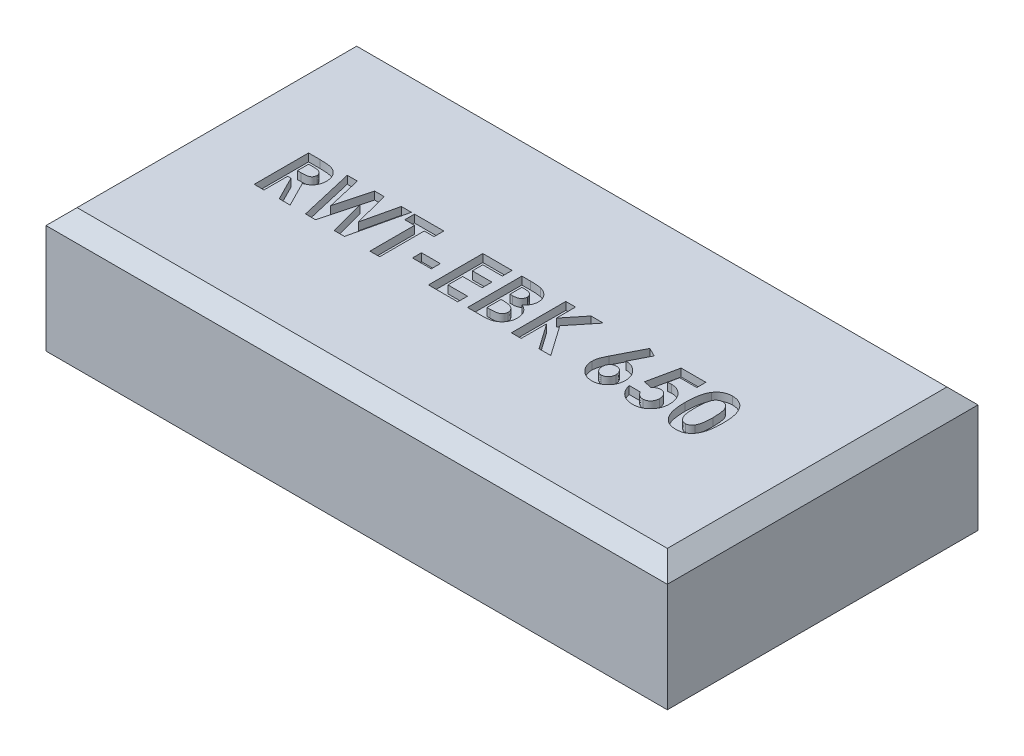
from build123d import *

# Parameters (mm, degrees)
SKETCH1_W           = 40
SKETCH1_H           = 20
BOSS_EXTRUDE1_DEPTH = 8
CHAMFER1_SIZE       = 1
SKETCH4_W           = 1.211538461
SKETCH4_H           = 0.583333333
CUT_EXTRUDE3_DEPTH  = 0.5


with BuildPart() as part:
    # Sketch1 → Boss-Extrude1 (new body)
    with BuildSketch(Plane(origin=(0, 0, 0), x_dir=(1, 0, 0), z_dir=(0, 1, 0))):
        with Locations((0, 2.318501171)):
            Rectangle(SKETCH1_W, SKETCH1_H)
    extrude(amount=BOSS_EXTRUDE1_DEPTH)

    # Chamfer1
    chamfer1_edges = [part.edges().sort_by_distance(p)[0] for p in [
        (0, 8, 7.681498829),
        (-20, 8, -2.318501171),
        (0, 8, -12.318501171),
        (20, 8, -2.318501171),
    ]]
    chamfer(chamfer1_edges, length=CHAMFER1_SIZE)

    # Sketch4 → Cut-Extrude3 (cut)
    # profile 1 of 10: a face of its own
    with BuildSketch(Plane(origin=(0, 8, 0), x_dir=(1, 0, 0), z_dir=(0, 1, 0))):
        with BuildLine():
            Line((-14.596153846, 3.818501171), (-13.864182692, 3.818501171))
            add(Edge.make_bspline(
                [(-13.864182692, 3.818501171), (-13.815799622, 3.818329439), (-13.722745349, 3.81799915), (-13.588566169, 3.81278806), (-13.46530414, 3.805536401), (-13.352776761, 3.794470177), (-13.251032173, 3.779797701), (-13.159968404, 3.76250128), (-13.079588115, 3.742788301), (-13.009213411, 3.718224373), (-12.945703721, 3.690516634), (-12.886503859, 3.658679935), (-12.830307791, 3.623068786), (-12.777491125, 3.582746162), (-12.727594872, 3.538437457), (-12.6805249, 3.49009807), (-12.636946351, 3.437318103), (-12.597129066, 3.380431058), (-12.560838815, 3.320587191), (-12.528765845, 3.257704336), (-12.502684052, 3.191738763), (-12.479637993, 3.123643816), (-12.463038663, 3.052446065), (-12.451494071, 2.978838632), (-12.443041573, 2.902562411), (-12.442555595, 2.850743733), (-12.442307692, 2.824310466)],
                knots=[0, 0, 0, 0, 1.749336639, 3.364467119, 4.854658419, 6.213483162, 7.451590619, 8.570285859, 9.5643256, 10.440900261, 11.26203566, 12.067320669, 12.869050712, 13.665104639, 14.467235401, 15.27997916, 16.102287765, 16.939272006, 17.78853747, 18.631303466, 19.488103222, 20.351255419, 21.228522269, 22.127379805, 23.044756219, 24, 24, 24, 24], degree=3))
            add(Edge.make_bspline(
                [(-12.442307692, 2.824310466), (-12.442951654, 2.796720207), (-12.444214347, 2.742620739), (-12.451015895, 2.663153032), (-12.46344699, 2.587123888), (-12.48227569, 2.514755912), (-12.503916836, 2.4451484), (-12.532694008, 2.379585653), (-12.565171892, 2.317114157), (-12.603744925, 2.258617595), (-12.646076944, 2.20279664), (-12.695308193, 2.151790002), (-12.748249241, 2.102856265), (-12.807876098, 2.059060474), (-12.871560358, 2.017441316), (-12.940567358, 1.979723274), (-13.014446736, 1.944958206), (-13.066387598, 1.925570802), (-13.092948718, 1.91565662)],
                knots=[0, 0, 0, 0, 1.099860209, 2.156625411, 3.176576793, 4.16617041, 5.135385252, 6.078461593, 7.016046972, 7.938469504, 8.868247731, 9.803980173, 10.76021508, 11.73834243, 12.748633912, 13.790971185, 14.870363756, 16, 16, 16, 16], degree=3))
            Line((-13.092948718, 1.91565662), (-12.28525641, 0.318501171))
            Line((-12.28525641, 0.318501171), (-12.983573718, 0.318501171))
            Line((-12.983573718, 0.318501171), (-13.754807692, 1.844142197))
            Line((-13.754807692, 1.844142197), (-13.967948718, 1.844142197))
            Line((-13.967948718, 1.844142197), (-13.967948718, 0.318501171))
            Line((-13.967948718, 0.318501171), (-14.596153846, 0.318501171))
            Line((-14.596153846, 0.318501171), (-14.596153846, 3.818501171))
        make_face()
        with BuildLine():
            Line((-13.967948718, 2.472347325), (-13.723257212, 2.472347325))
            add(Edge.make_bspline(
                [(-13.723257212, 2.472347325), (-13.693341641, 2.472684254), (-13.636059751, 2.473329401), (-13.55368087, 2.476321861), (-13.4788612, 2.483532211), (-13.41127944, 2.492642218), (-13.350595524, 2.503161037), (-13.297350732, 2.518235143), (-13.250724642, 2.534387429), (-13.211269776, 2.554460531), (-13.177560445, 2.577288002), (-13.148454596, 2.603220576), (-13.124379885, 2.633234229), (-13.104565169, 2.666513318), (-13.089151475, 2.70335219), (-13.07790066, 2.743346436), (-13.071613117, 2.786951643), (-13.070889714, 2.817045173), (-13.070512821, 2.832723927)],
                knots=[0, 0, 0, 0, 1.688639943, 3.233382647, 4.650958383, 5.928841754, 7.082724185, 8.122798841, 9.049171256, 9.863274652, 10.613301712, 11.341792392, 12.054588806, 12.776240173, 13.521029143, 14.301969904, 15.115324896, 16, 16, 16, 16], degree=3))
            add(Edge.make_bspline(
                [(-13.070512821, 2.832723927), (-13.071225372, 2.851273039), (-13.072625049, 2.88770933), (-13.086514186, 2.940164814), (-13.108622693, 2.988715953), (-13.1389274, 3.033143381), (-13.177092239, 3.072091531), (-13.220889403, 3.106424636), (-13.27126414, 3.133572687), (-13.317907356, 3.151479252), (-13.36034178, 3.162192934), (-13.398637509, 3.170176676), (-13.442984193, 3.175834983), (-13.493415313, 3.181836624), (-13.549802317, 3.185728385), (-13.612452548, 3.188568594), (-13.681186076, 3.189730664), (-13.729099873, 3.190102157), (-13.754106571, 3.190296043)],
                knots=[0, 0, 0, 0, 1.020303359, 2.004196876, 2.966617323, 3.9489082, 4.950758222, 5.960522915, 7.003732012, 8.091992268, 8.70421221, 9.413913587, 10.24622431, 11.166358409, 12.212345909, 13.359657661, 14.621978493, 16, 16, 16, 16], degree=3))
            Line((-13.754106571, 3.190296043), (-13.967948718, 3.190296043))
            Line((-13.967948718, 3.190296043), (-13.967948718, 2.472347325))
        make_face(mode=Mode.SUBTRACT)
    # profile 2 of 10: a face of its own
    with BuildSketch(Plane(origin=(0, 8, 0), x_dir=(1, 0, 0), z_dir=(0, 1, 0))):
        Polygon((-12.105769231, 3.818501171), (-11.457231571, 3.818501171), (-10.939102564, 1.584026011), (-10.345252404, 3.818501171), (-9.734575321, 3.818501171), (-9.144230769, 1.584026011), (-8.627504006, 3.818501171), (-7.977564103, 3.818501171), (-8.787359776, 0.318501171), (-9.443609776, 0.318501171), (-10.041666667, 2.581021203), (-10.643229167, 0.318501171), (-11.294571314, 0.318501171), align=None)
    # profile 3 of 10: a face of its own
    with BuildSketch(Plane(origin=(0, 8, 0), x_dir=(1, 0, 0), z_dir=(0, 1, 0))):
        Polygon((-7.775641026, 3.818501171), (-5.891025641, 3.818501171), (-5.891025641, 3.190296043), (-6.519230769, 3.190296043), (-6.519230769, 0.318501171), (-7.147435897, 0.318501171), (-7.147435897, 3.190296043), (-7.775641026, 3.190296043), align=None)
    # profile 4 of 10: a face of its own
    with BuildSketch(Plane(origin=(0, 8, 0), x_dir=(1, 0, 0), z_dir=(0, 1, 0))):
        with Locations((-4.791666667, 1.597347325)):
            Rectangle(SKETCH4_W, SKETCH4_H)
    # profile 5 of 10: a face of its own
    with BuildSketch(Plane(origin=(0, 8, 0), x_dir=(1, 0, 0), z_dir=(0, 1, 0))):
        Polygon((-3.378205128, 3.818501171), (-1.493589744, 3.818501171), (-1.493589744, 3.190296043), (-2.75, 3.190296043), (-2.75, 2.51721912), (-1.493589744, 2.51721912), (-1.493589744, 1.889013991), (-2.75, 1.889013991), (-2.75, 0.946706299), (-1.493589744, 0.946706299), (-1.493589744, 0.318501171), (-3.378205128, 0.318501171), align=None)
    # profile 6 of 10: a face of its own
    with BuildSketch(Plane(origin=(0, 8, 0), x_dir=(1, 0, 0), z_dir=(0, 1, 0))):
        with BuildLine():
            Line((-0.865384615, 0.318501171), (-0.865384615, 3.818501171))
            Line((-0.865384615, 3.818501171), (-0.304487179, 3.818501171))
            add(Edge.make_bspline(
                [(-0.304487179, 3.818501171), (-0.265220852, 3.818505652), (-0.189241252, 3.818514323), (-0.079622519, 3.814664873), (0.022039599, 3.809685178), (0.115421572, 3.804114058), (0.200682344, 3.794513904), (0.277692262, 3.784396391), (0.346605192, 3.772195293), (0.389210312, 3.76125053), (0.409254808, 3.756101331)],
                knots=[0, 0, 0, 0, 1.311965854, 2.538629056, 3.664479157, 4.713267157, 5.663616078, 6.530575999, 7.308677837, 8, 8, 8, 8], degree=3))
            add(Edge.make_bspline(
                [(0.409254808, 3.756101331), (0.435575266, 3.748838294), (0.487224455, 3.734585883), (0.561202576, 3.705802524), (0.631381143, 3.673807779), (0.697674471, 3.637307759), (0.759675491, 3.595861807), (0.817148578, 3.549140995), (0.871333285, 3.499020694), (0.920305637, 3.444104065), (0.964568575, 3.386074475), (1.003025131, 3.324947127), (1.03643895, 3.2616567), (1.063178757, 3.195406725), (1.083326699, 3.126502301), (1.09806282, 3.055237661), (1.107613822, 2.981387306), (1.108516267, 2.931144495), (1.108974359, 2.905640594)],
                knots=[0, 0, 0, 0, 1.099996261, 2.158545794, 3.195537121, 4.207578794, 5.205712374, 6.197378256, 7.190519799, 8.17788031, 9.159561366, 10.129234751, 11.085776129, 12.040971148, 13.00380137, 13.975669004, 14.972423361, 16, 16, 16, 16], degree=3))
            add(Edge.make_bspline(
                [(1.108974359, 2.905640594), (1.107776583, 2.872874775), (1.105418909, 2.808379286), (1.090357925, 2.713647082), (1.062116233, 2.624111532), (1.025162666, 2.538122532), (0.974917368, 2.456000819), (0.911115557, 2.377785442), (0.834790614, 2.30106803), (0.776245169, 2.255081117), (0.745793269, 2.231161427)],
                knots=[0, 0, 0, 0, 0.986156485, 1.941127874, 2.875419072, 3.804401753, 4.751181392, 5.761612777, 6.835722519, 8, 8, 8, 8], degree=3))
            add(Edge.make_bspline(
                [(0.745793269, 2.231161427), (0.770470028, 2.218564156), (0.818854324, 2.193864392), (0.887545811, 2.153265354), (0.951146629, 2.110083128), (1.009941945, 2.065186558), (1.062698461, 2.016672412), (1.111594582, 1.967336144), (1.154218027, 1.914350989), (1.192333195, 1.85960544), (1.225462281, 1.802306775), (1.254314061, 1.742551757), (1.278684124, 1.680136252), (1.299321324, 1.615377904), (1.314712554, 1.548053973), (1.324747963, 1.478140383), (1.332431699, 1.405875574), (1.333029422, 1.35665059), (1.333333333, 1.331622165)],
                knots=[0, 0, 0, 0, 1.164658916, 2.283573913, 3.35186032, 4.395461096, 5.390182219, 6.362969632, 7.312859996, 8.245001507, 9.165155236, 10.092416118, 11.032087915, 11.979892451, 12.947605196, 13.931445124, 14.948243989, 16, 16, 16, 16], degree=3))
            add(Edge.make_bspline(
                [(1.333333333, 1.331622165), (1.331361149, 1.283819302), (1.327469051, 1.189480545), (1.29901193, 1.050969584), (1.249676325, 0.91964863), (1.18342878, 0.796039608), (1.101799059, 0.683720797), (1.007948289, 0.585330494), (0.902821331, 0.502045287), (0.805829006, 0.445834233), (0.721938284, 0.40811136), (0.652453165, 0.384788701), (0.577827621, 0.363182624), (0.49669469, 0.348010391), (0.410525202, 0.334123096), (0.318478999, 0.325548791), (0.220728113, 0.319738197), (0.153588579, 0.318921849), (0.118990385, 0.318501171)],
                knots=[0, 0, 0, 0, 1.284142165, 2.534249414, 3.780121997, 5.041676246, 6.291546858, 7.49970053, 8.684500223, 9.883330709, 10.50184324, 11.153274765, 11.851151195, 12.587658647, 13.369265475, 14.195992086, 15.070362669, 16, 16, 16, 16], degree=3))
            Line((0.118990385, 0.318501171), (-0.865384615, 0.318501171))
        make_face()
        with BuildLine():
            Line((-0.237179487, 3.190296043), (-0.237179487, 2.42747553))
            Line((-0.237179487, 2.42747553), (-0.0703125, 2.42747553))
            add(Edge.make_bspline(
                [(-0.0703125, 2.42747553), (-0.047633777, 2.427673297), (-0.003853875, 2.428055074), (0.059381549, 2.432972233), (0.118180282, 2.441361212), (0.172319311, 2.453065948), (0.222302963, 2.467929257), (0.267811927, 2.485813017), (0.308646108, 2.507633149), (0.356085982, 2.540135198), (0.406233349, 2.587963419), (0.450377513, 2.657061193), (0.476378131, 2.736523371), (0.479273899, 2.792566252), (0.480769231, 2.821505979)],
                knots=[0, 0, 0, 0, 1.065314748, 2.056525647, 2.977365736, 3.853934255, 4.656397591, 5.425096493, 6.14721249, 6.826394842, 8.123232004, 9.372140726, 10.643011755, 12, 12, 12, 12], degree=3))
            add(Edge.make_bspline(
                [(0.480769231, 2.821505979), (0.479572691, 2.848612841), (0.47725923, 2.901022871), (0.451079951, 2.97461122), (0.410418355, 3.039825558), (0.362411626, 3.084459439), (0.317203962, 3.114943064), (0.278494386, 3.135015233), (0.236007719, 3.152983634), (0.188921466, 3.166722711), (0.137504514, 3.17703203), (0.082006625, 3.184602991), (0.022332045, 3.189756109), (-0.018885315, 3.190112204), (-0.040164263, 3.190296043)],
                knots=[0, 0, 0, 0, 1.347982417, 2.606269829, 3.849316587, 5.153353503, 5.842674298, 6.568177932, 7.326619318, 8.142485038, 9.012069166, 9.942760135, 10.937925643, 12, 12, 12, 12], degree=3))
            Line((-0.040164263, 3.190296043), (-0.237179487, 3.190296043))
        make_face(mode=Mode.SUBTRACT)
        with BuildLine():
            Line((-0.237179487, 1.844142197), (-0.237179487, 0.946706299))
            Line((-0.237179487, 0.946706299), (-0.056290064, 0.946706299))
            add(Edge.make_bspline(
                [(-0.056290064, 0.946706299), (-0.020527995, 0.946910607), (0.048229046, 0.947303413), (0.146723385, 0.952049449), (0.236279363, 0.960603342), (0.316659689, 0.971282188), (0.387987483, 0.985750355), (0.450021639, 1.004144774), (0.503612874, 1.02438184), (0.548439854, 1.049377018), (0.585060929, 1.078465208), (0.618107609, 1.108194036), (0.645051813, 1.142489048), (0.666370569, 1.179878054), (0.684821916, 1.219432285), (0.695950465, 1.262696318), (0.704423352, 1.308387911), (0.704889637, 1.339991798), (0.705128205, 1.356161427)],
                knots=[0, 0, 0, 0, 1.753078804, 3.370512758, 4.83203934, 6.162291463, 7.344201807, 8.395507345, 9.331626367, 10.147333109, 10.898971645, 11.62040215, 12.321813352, 13.025280112, 13.727906689, 14.453419512, 15.208716525, 16, 16, 16, 16], degree=3))
            add(Edge.make_bspline(
                [(0.705128205, 1.356161427), (0.704602095, 1.374651653), (0.703577374, 1.410665639), (0.695208464, 1.463303922), (0.67999942, 1.512445252), (0.660842888, 1.559346239), (0.634185556, 1.602327663), (0.602504228, 1.642876951), (0.564225095, 1.679620976), (0.521177978, 1.714782156), (0.470967777, 1.745567673), (0.413570936, 1.772279563), (0.348675643, 1.79458835), (0.27608088, 1.81235062), (0.196104895, 1.827425213), (0.108163951, 1.83642641), (0.012990452, 1.843120995), (-0.053004401, 1.843794061), (-0.087139423, 1.844142197)],
                knots=[0, 0, 0, 0, 0.845221588, 1.646264278, 2.427170338, 3.19324141, 3.95557735, 4.731569926, 5.540061037, 6.376114724, 7.268642756, 8.224665384, 9.265483498, 10.400594375, 11.639216012, 12.983232105, 14.439614077, 16, 16, 16, 16], degree=3))
            Line((-0.087139423, 1.844142197), (-0.237179487, 1.844142197))
        make_face(mode=Mode.SUBTRACT)
    # profile 7 of 10: a face of its own
    with BuildSketch(Plane(origin=(0, 8, 0), x_dir=(1, 0, 0), z_dir=(0, 1, 0))):
        Polygon((1.961538462, 3.818501171), (2.58974359, 3.818501171), (2.58974359, 2.586630177), (3.582532051, 3.818501171), (4.375500801, 3.818501171), (3.128205128, 2.270424248), (4.496794872, 0.318501171), (3.740284455, 0.318501171), (2.58974359, 1.959827293), (2.58974359, 0.318501171), (1.961538462, 0.318501171), align=None)
    # profile 8 of 10: a face of its own
    with BuildSketch(Plane(origin=(0, 8, 0), x_dir=(1, 0, 0), z_dir=(0, 1, 0))):
        with BuildLine():
            Line((7.287259615, 3.908244761), (7.843249199, 3.626393799))
            Line((7.843249199, 3.626393799), (7.233273237, 2.42747553))
            add(Edge.make_bspline(
                [(7.233273237, 2.42747553), (7.269310045, 2.426542519), (7.340290447, 2.4247048), (7.444723706, 2.409852053), (7.544563845, 2.384175214), (7.640817549, 2.350140634), (7.732308207, 2.304431854), (7.820509327, 2.250058876), (7.903139102, 2.183745181), (7.982092161, 2.110273125), (8.053883772, 2.028876646), (8.116247478, 1.941413544), (8.170596347, 1.850011807), (8.21284497, 1.752626555), (8.246924117, 1.650872061), (8.271513721, 1.544341567), (8.285542778, 1.432726586), (8.287476918, 1.356901473), (8.288461538, 1.31830085)],
                knots=[0, 0, 0, 0, 1.013260694, 1.995783107, 2.958651975, 3.908806537, 4.861209129, 5.829647963, 6.817170299, 7.835534541, 8.860094905, 9.863329007, 10.853101798, 11.844815043, 12.84250023, 13.867713965, 14.914507806, 16, 16, 16, 16], degree=3))
            add(Edge.make_bspline(
                [(8.288461538, 1.31830085), (8.287538867, 1.281092192), (8.285715142, 1.20754663), (8.270639637, 1.099526903), (8.246276829, 0.995888293), (8.211457485, 0.896837778), (8.167199282, 0.801891196), (8.113074498, 0.711104263), (8.048634272, 0.6251554), (7.975543562, 0.544501298), (7.895642808, 0.470984488), (7.81142306, 0.405638468), (7.722170652, 0.351660177), (7.629572559, 0.306074244), (7.531923994, 0.272057263), (7.430686271, 0.246380336), (7.325091675, 0.231563634), (7.253416769, 0.229700417), (7.217147436, 0.228757581)],
                knots=[0, 0, 0, 0, 1.049934834, 2.075270938, 3.072134561, 4.05064612, 5.033440221, 6.024524368, 7.028587226, 8.060776465, 9.092543989, 10.090062252, 11.064205434, 12.031961459, 12.998029633, 13.977230324, 14.976426867, 16, 16, 16, 16], degree=3))
            add(Edge.make_bspline(
                [(7.217147436, 0.228757581), (7.179220735, 0.229531316), (7.104643009, 0.231052761), (6.995517131, 0.248088938), (6.890856023, 0.273734527), (6.791247896, 0.31035207), (6.696073317, 0.356977567), (6.606452795, 0.414671928), (6.521631401, 0.482798942), (6.442513456, 0.559825856), (6.371234084, 0.644198302), (6.307658842, 0.731798868), (6.253874104, 0.822765019), (6.210336613, 0.916999493), (6.176367653, 1.01420201), (6.152732185, 1.114557051), (6.137331496, 1.217798425), (6.135526117, 1.287863863), (6.134615385, 1.323208703)],
                knots=[0, 0, 0, 0, 1.063775006, 2.091769615, 3.092589432, 4.084662827, 5.064601646, 6.061867366, 7.070035304, 8.113879863, 9.156342271, 10.166834137, 11.149076039, 12.117706134, 13.076241869, 14.034148791, 15.008317125, 16, 16, 16, 16], degree=3))
            add(Edge.make_bspline(
                [(6.134615385, 1.323208703), (6.135096598, 1.350579146), (6.136061702, 1.405472389), (6.145760426, 1.487672036), (6.160505893, 1.570087449), (6.17759782, 1.639632185), (6.19519736, 1.698439537), (6.212911432, 1.748206609), (6.234864121, 1.803437178), (6.259959296, 1.86427228), (6.28898611, 1.930638729), (6.321792931, 2.002355629), (6.358461434, 2.079966073), (6.384611127, 2.133272431), (6.398237179, 2.161049248)],
                knots=[0, 0, 0, 0, 1.110454016, 2.227089276, 3.35462975, 4.507227546, 5.131400587, 5.845402449, 6.650387134, 7.543487832, 8.516250726, 9.590168902, 10.744287919, 12, 12, 12, 12], degree=3))
            Line((6.398237179, 2.161049248), (7.287259615, 3.908244761))
        make_face()
        with BuildLine():
            add(Edge.make_bspline(
                [(7.203125, 1.844142197), (7.172981806, 1.842759592), (7.113995532, 1.840054016), (7.030125872, 1.81171991), (6.953655771, 1.767270749), (6.887370541, 1.705366696), (6.831929046, 1.631388922), (6.79118869, 1.547007389), (6.766681101, 1.453348146), (6.76413492, 1.387863165), (6.762820513, 1.354058062)],
                knots=[0, 0, 0, 0, 0.981744412, 1.921144944, 2.858899012, 3.85339082, 4.86292663, 5.863643845, 6.897155691, 8, 8, 8, 8], degree=3))
            add(Edge.make_bspline(
                [(6.762820513, 1.354058062), (6.764376812, 1.320241702), (6.767403918, 1.254466622), (6.792833024, 1.159915576), (6.83446836, 1.073617836), (6.892859264, 0.998659696), (6.961409347, 0.936438636), (7.037423258, 0.890423187), (7.119633057, 0.862154387), (7.176499583, 0.858705218), (7.205228365, 0.856962709)],
                knots=[0, 0, 0, 0, 1.098279937, 2.136227893, 3.159405121, 4.194678092, 5.206500211, 6.154139736, 7.067477469, 8, 8, 8, 8], degree=3))
            add(Edge.make_bspline(
                [(7.205228365, 0.856962709), (7.235569206, 0.858736253), (7.295072865, 0.862214481), (7.380910794, 0.889293782), (7.459324258, 0.934538321), (7.528656928, 0.996560175), (7.588212374, 1.070662942), (7.629418727, 1.157467583), (7.656023432, 1.252701065), (7.658813782, 1.319514894), (7.66025641, 1.354058062)],
                knots=[0, 0, 0, 0, 0.96921794, 1.900804717, 2.848419905, 3.844199796, 4.861108892, 5.867439427, 6.897452859, 8, 8, 8, 8], degree=3))
            add(Edge.make_bspline(
                [(7.66025641, 1.354058062), (7.658612993, 1.387843426), (7.655430323, 1.453272729), (7.631524703, 1.547370744), (7.588842831, 1.631427039), (7.532146927, 1.705672064), (7.463580512, 1.767548514), (7.384049921, 1.81207045), (7.296348955, 1.840003817), (7.234652722, 1.842742624), (7.203125, 1.844142197)],
                knots=[0, 0, 0, 0, 1.083229974, 2.097801324, 3.086792542, 4.086858909, 5.079819718, 6.026392613, 6.991456328, 8, 8, 8, 8], degree=3))
        make_face(mode=Mode.SUBTRACT)
    # profile 9 of 10: a face of its own
    with BuildSketch(Plane(origin=(0, 8, 0), x_dir=(1, 0, 0), z_dir=(0, 1, 0))):
        with BuildLine():
            Line((9.387119391, 3.818501171), (10.980769231, 3.818501171))
            Line((10.980769231, 3.818501171), (10.980769231, 3.235167838))
            Line((10.980769231, 3.235167838), (9.884915865, 3.235167838))
            Line((9.884915865, 3.235167838), (9.748197115, 2.573308863))
            add(Edge.make_bspline(
                [(9.748197115, 2.573308863), (9.766827002, 2.578497522), (9.803568967, 2.588730623), (9.858920782, 2.598993128), (9.912564404, 2.605644958), (9.947765022, 2.606532224), (9.96484375, 2.606962709)],
                knots=[0, 0, 0, 0, 1.05461699, 2.079921384, 3.068411212, 4, 4, 4, 4], degree=3))
            add(Edge.make_bspline(
                [(9.96484375, 2.606962709), (10.002060088, 2.606109919), (10.075421688, 2.60442888), (10.1827404, 2.588470341), (10.285504407, 2.563336125), (10.383399238, 2.527489548), (10.476329265, 2.480834303), (10.564407137, 2.424394534), (10.647740954, 2.358071113), (10.724850358, 2.281822516), (10.795701698, 2.19809983), (10.857302898, 2.107544887), (10.909914167, 2.011448911), (10.951759351, 1.909214572), (10.984787138, 1.801483971), (11.008653754, 1.688188071), (11.022767277, 1.569192598), (11.024670399, 1.488010495), (11.025641026, 1.446606139)],
                knots=[0, 0, 0, 0, 1.01440847, 1.999622559, 2.951875003, 3.895578053, 4.836219714, 5.782137149, 6.743708247, 7.735272588, 8.734977101, 9.730283169, 10.717124674, 11.717316708, 12.737475749, 13.78628267, 14.87096371, 16, 16, 16, 16], degree=3))
            add(Edge.make_bspline(
                [(11.025641026, 1.446606139), (11.024454904, 1.404731748), (11.022114339, 1.322101333), (11.006844297, 1.200605395), (10.979892399, 1.084239715), (10.94287127, 0.972692784), (10.894098303, 0.866784445), (10.835442135, 0.765417568), (10.765911048, 0.669344566), (10.68618738, 0.579550304), (10.599517296, 0.497476624), (10.507234115, 0.425276252), (10.409986156, 0.364520223), (10.30777107, 0.31541908), (10.2011753, 0.276571129), (10.090166491, 0.248291676), (9.974205155, 0.232074981), (9.895482475, 0.229875532), (9.85546875, 0.228757581)],
                knots=[0, 0, 0, 0, 1.06808661, 2.107647099, 3.116961351, 4.110378221, 5.100014249, 6.085620622, 7.093190682, 8.119403071, 9.144090782, 10.133780668, 11.103064255, 12.062861538, 13.020824475, 13.992378307, 14.979551724, 16, 16, 16, 16], degree=3))
            add(Edge.make_bspline(
                [(9.85546875, 0.228757581), (9.819685666, 0.229672135), (9.749113937, 0.231475826), (9.645164879, 0.242562264), (9.544946443, 0.262163189), (9.44899068, 0.290530803), (9.356287975, 0.32544486), (9.267909998, 0.369111487), (9.183371097, 0.420699211), (9.102911331, 0.479266557), (9.027838055, 0.545240399), (8.959319124, 0.617460138), (8.896939715, 0.695015476), (8.84203465, 0.778863212), (8.79477604, 0.868879466), (8.75286614, 0.964003375), (8.718562467, 1.065228337), (8.701154341, 1.135403104), (8.692307692, 1.171065274)],
                knots=[0, 0, 0, 0, 1.054957082, 2.080596141, 3.077793124, 4.061112343, 5.027190972, 5.994718051, 6.962465889, 7.943658696, 8.924948258, 9.904494768, 10.875059, 11.855380583, 12.854004648, 13.869083016, 14.917087635, 16, 16, 16, 16], degree=3))
            Line((8.692307692, 1.171065274), (9.41025641, 1.171065274))
            add(Edge.make_bspline(
                [(9.41025641, 1.171065274), (9.42338053, 1.146352842), (9.448885759, 1.098327052), (9.497402344, 1.034565599), (9.551713581, 0.980192572), (9.611329552, 0.934676733), (9.676636533, 0.900577041), (9.744973386, 0.874717413), (9.8171986, 0.859774091), (9.86638716, 0.857906028), (9.891225962, 0.856962709)],
                knots=[0, 0, 0, 0, 1.104910296, 2.147267069, 3.153527244, 4.136738762, 5.099945312, 6.05603338, 7.018353, 8, 8, 8, 8], degree=3))
            add(Edge.make_bspline(
                [(9.891225962, 0.856962709), (9.908538273, 0.857614079), (9.942600538, 0.858895659), (9.9927859, 0.86567554), (10.040690032, 0.87851648), (10.086669091, 0.896298197), (10.130846587, 0.918474006), (10.172589223, 0.946469521), (10.212623243, 0.978693396), (10.250339168, 1.015670402), (10.284498925, 1.056891163), (10.314453296, 1.10118568), (10.341236634, 1.14756972), (10.361075462, 1.197880672), (10.377321784, 1.250616232), (10.389286233, 1.306174201), (10.396436341, 1.364619465), (10.397098249, 1.404518409), (10.397435897, 1.424871363)],
                knots=[0, 0, 0, 0, 0.978869489, 1.925942215, 2.855067702, 3.774946051, 4.70828698, 5.642468714, 6.60995405, 7.609372294, 8.622401667, 9.629904756, 10.629323, 11.642352373, 12.678539694, 13.745912462, 14.850161547, 16, 16, 16, 16], degree=3))
            add(Edge.make_bspline(
                [(10.397435897, 1.424871363), (10.397044018, 1.444751879), (10.396281215, 1.483449786), (10.389971156, 1.540272174), (10.378682582, 1.594186337), (10.363301804, 1.645605217), (10.343612571, 1.694216573), (10.319551013, 1.740309765), (10.291014335, 1.783651807), (10.257849331, 1.823360298), (10.222482512, 1.859782055), (10.184487184, 1.891636234), (10.144205664, 1.918072991), (10.102889652, 1.941153049), (10.05888996, 1.957950212), (10.013195966, 1.969517798), (9.965855722, 1.978005628), (9.933565969, 1.978504319), (9.917167468, 1.978757581)],
                knots=[0, 0, 0, 0, 1.166249705, 2.270133367, 3.348514167, 4.393962215, 5.415026464, 6.420877785, 7.440098956, 8.453121383, 9.451844239, 10.415694839, 11.355045125, 12.27538808, 13.187007209, 14.108269027, 15.039275622, 16, 16, 16, 16], degree=3))
            add(Edge.make_bspline(
                [(9.917167468, 1.978757581), (9.899354884, 1.978081693), (9.863654645, 1.976727067), (9.810613025, 1.965704839), (9.75821094, 1.94786674), (9.706156979, 1.923256255), (9.654967869, 1.891048895), (9.603292704, 1.853273355), (9.552861163, 1.807184883), (9.520795387, 1.772858084), (9.504206731, 1.755099729)],
                knots=[0, 0, 0, 0, 0.88288272, 1.769486374, 2.674910571, 3.623812639, 4.617874466, 5.670434592, 6.794841017, 8, 8, 8, 8], degree=3))
            Line((9.504206731, 1.755099729), (8.975560897, 1.876393799))
            Line((8.975560897, 1.876393799), (9.387119391, 3.818501171))
        make_face()
    # profile 10 of 10: a face of its own
    with BuildSketch(Plane(origin=(0, 8, 0), x_dir=(1, 0, 0), z_dir=(0, 1, 0))):
        with BuildLine():
            add(Edge.make_bspline(
                [(12.608072917, 3.908244761), (12.638480652, 3.907793349), (12.698270385, 3.906905754), (12.786329406, 3.897292372), (12.871154591, 3.882769234), (12.953077785, 3.86251452), (13.031509297, 3.835708128), (13.107019968, 3.803621336), (13.178711003, 3.764571127), (13.247496691, 3.720461909), (13.313350535, 3.670524021), (13.374689786, 3.613592251), (13.432634627, 3.550976601), (13.485930767, 3.481730434), (13.535758465, 3.406483618), (13.581953994, 3.325224221), (13.624163718, 3.237554532), (13.662860706, 3.143316345), (13.697463675, 3.04109707), (13.726609713, 2.929724208), (13.751607317, 2.809172324), (13.772707059, 2.679141347), (13.788655053, 2.539458435), (13.799404323, 2.390216385), (13.80678098, 2.231702915), (13.807383012, 2.122963977), (13.807692308, 2.067098927)],
                knots=[0, 0, 0, 0, 0.879237366, 1.728815576, 2.559023295, 3.367336655, 4.166867292, 4.954216142, 5.737608147, 6.525189134, 7.316157332, 8.124696809, 8.942788509, 9.781158001, 10.649253743, 11.551476218, 12.482711956, 13.461909668, 14.496590415, 15.601789533, 16.789733467, 18.056700938, 19.410929216, 20.8549011, 22.384193279, 24, 24, 24, 24], degree=3))
            add(Edge.make_bspline(
                [(13.807692308, 2.067098927), (13.807358042, 2.010534943), (13.806708571, 1.900632136), (13.799710973, 1.740668821), (13.787660778, 1.590343185), (13.772129618, 1.449670779), (13.750856176, 1.31872589), (13.725942019, 1.19716946), (13.69633592, 1.085045549), (13.660593141, 0.982606796), (13.622130387, 0.888203106), (13.579805201, 0.800704352), (13.534355307, 0.71987354), (13.486823186, 0.644491226), (13.434602955, 0.576779642), (13.380236318, 0.514436242), (13.321356056, 0.459835764), (13.260441254, 0.410164346), (13.195260358, 0.367238273), (13.12648556, 0.329695837), (13.052890726, 0.299244462), (12.975817364, 0.272759483), (12.893951743, 0.253746125), (12.808594697, 0.238659651), (12.718782561, 0.23032194), (12.657634842, 0.229287592), (12.626302083, 0.228757581)],
                knots=[0, 0, 0, 0, 1.643780988, 3.193836972, 4.651895693, 6.025988579, 7.305620092, 8.505800249, 9.631074763, 10.672816429, 11.65661981, 12.592235626, 13.49536222, 14.350718032, 15.179365177, 15.97804903, 16.751647189, 17.51006938, 18.259804725, 19.016521909, 19.783502495, 20.571750527, 21.382245291, 22.22305063, 23.089471752, 24, 24, 24, 24], degree=3))
            add(Edge.make_bspline(
                [(12.626302083, 0.228757581), (12.59497017, 0.229297816), (12.533591414, 0.230356128), (12.443536417, 0.238597657), (12.357727022, 0.253807241), (12.275213712, 0.272905453), (12.196570768, 0.299185861), (12.1214211, 0.330548319), (12.050342543, 0.367856509), (11.983138292, 0.410882596), (11.920037802, 0.460221675), (11.86006049, 0.515346009), (11.803339031, 0.576115872), (11.750736299, 0.643211936), (11.701390812, 0.71573861), (11.655817167, 0.794524112), (11.614042751, 0.879453732), (11.574760854, 0.970645855), (11.540629858, 1.070063741), (11.510254856, 1.17859518), (11.485372454, 1.297144871), (11.46536036, 1.425674728), (11.449382717, 1.563912456), (11.437497186, 1.711924777), (11.43046072, 1.869780633), (11.429818059, 1.978282826), (11.429487179, 2.034146203)],
                knots=[0, 0, 0, 0, 0.917216111, 1.796812873, 2.643793957, 3.46689424, 4.273913431, 5.068098542, 5.848489301, 6.620921603, 7.401012384, 8.190319798, 9.003608147, 9.831726257, 10.68377682, 11.569763213, 12.493818149, 13.453288342, 14.474581811, 15.568529029, 16.750744269, 18.018426408, 19.375425659, 20.823733699, 22.36466933, 24, 24, 24, 24], degree=3))
            add(Edge.make_bspline(
                [(11.429487179, 2.034146203), (11.430086537, 2.111763968), (11.431243006, 2.261528446), (11.445898626, 2.477894573), (11.46740936, 2.677887577), (11.499003532, 2.861172919), (11.538069289, 3.028429436), (11.588095025, 3.178555327), (11.645045686, 3.313627923), (11.693574966, 3.393645742), (11.716947115, 3.432183062)],
                knots=[0, 0, 0, 0, 1.288568992, 2.486310467, 3.599230591, 4.627010532, 5.572937695, 6.447898582, 7.252493626, 8, 8, 8, 8], degree=3))
            add(Edge.make_bspline(
                [(11.716947115, 3.432183062), (11.744123137, 3.470042113), (11.797257615, 3.544064019), (11.890164735, 3.641240945), (11.989981339, 3.72435141), (12.098757603, 3.791514551), (12.214773185, 3.844479409), (12.339024139, 3.881887892), (12.471051626, 3.903683818), (12.561717103, 3.906701743), (12.608072917, 3.908244761)],
                knots=[0, 0, 0, 0, 1.058512271, 2.069600068, 3.047294572, 4.004278952, 4.967380941, 5.939006123, 6.946246673, 8, 8, 8, 8], degree=3))
        make_face()
        with BuildLine():
            add(Edge.make_bspline(
                [(12.623497596, 3.280039632), (12.596008751, 3.278736716), (12.542116023, 3.276182308), (12.463915106, 3.254498986), (12.390176524, 3.221007927), (12.334085555, 3.180706674), (12.292102022, 3.142073089), (12.262767826, 3.107110952), (12.234479618, 3.068095726), (12.209494048, 3.023266856), (12.185901148, 2.974235095), (12.162843773, 2.920777869), (12.14394278, 2.861582152), (12.125373055, 2.797656056), (12.109104244, 2.727232193), (12.095474546, 2.649734927), (12.08329761, 2.564660285), (12.074804052, 2.471952543), (12.066885506, 2.371708697), (12.061209118, 2.263705442), (12.058835962, 2.147971914), (12.058081608, 2.068267952), (12.057692308, 2.027134985)],
                knots=[0, 0, 0, 0, 1.076674018, 2.110852608, 3.161083442, 4.239746716, 4.804137807, 5.395870207, 6.026861976, 6.692161227, 7.405688833, 8.16177676, 8.973626916, 9.841385931, 10.773283133, 11.807421078, 12.927755683, 14.143907515, 15.458935494, 16.872852025, 18.386167141, 20, 20, 20, 20], degree=3))
            add(Edge.make_bspline(
                [(12.057692308, 2.027134985), (12.05833305, 1.973845238), (12.05956172, 1.871658197), (12.065996919, 1.724709674), (12.078895741, 1.590974686), (12.094939272, 1.46954686), (12.117473067, 1.361213689), (12.143399656, 1.264950241), (12.175416688, 1.181983641), (12.212418538, 1.111114005), (12.253399754, 1.050825352), (12.297886667, 0.999579726), (12.344364656, 0.955203432), (12.394284452, 0.919157115), (12.44752696, 0.891532879), (12.503647703, 0.871663107), (12.562682345, 0.859499993), (12.603108659, 0.85781336), (12.623497596, 0.856962709)],
                knots=[0, 0, 0, 0, 1.771748488, 3.397459088, 4.888034009, 6.237357457, 7.467047327, 8.564189669, 9.548206622, 10.417051504, 11.216568818, 11.965764335, 12.669334354, 13.348544111, 14.005342236, 14.656555988, 15.322436492, 16, 16, 16, 16], degree=3))
            add(Edge.make_bspline(
                [(12.623497596, 0.856962709), (12.64318685, 0.857544788), (12.681735959, 0.858684424), (12.737949195, 0.87038264), (12.791108425, 0.889401398), (12.841053145, 0.916304766), (12.887962, 0.950516515), (12.931605729, 0.992186986), (12.971655179, 1.041731537), (12.994988171, 1.07850092), (13.007011218, 1.097447485)],
                knots=[0, 0, 0, 0, 0.992283464, 1.942767638, 2.88273346, 3.832339453, 4.79467288, 5.803907806, 6.868395428, 8, 8, 8, 8], degree=3))
            add(Edge.make_bspline(
                [(13.007011218, 1.097447485), (13.021166331, 1.12333736), (13.050848455, 1.177626329), (13.085196661, 1.269236938), (13.114109066, 1.372558565), (13.13899355, 1.487912756), (13.156013019, 1.615754481), (13.170670165, 1.755273086), (13.177739671, 1.907171129), (13.178889565, 2.012406641), (13.179487179, 2.067098927)],
                knots=[0, 0, 0, 0, 0.710965849, 1.490837728, 2.352621235, 3.297892224, 4.334225155, 5.461620853, 6.680770821, 8, 8, 8, 8], degree=3))
            add(Edge.make_bspline(
                [(13.179487179, 2.067098927), (13.179256334, 2.122265969), (13.178811995, 2.228453106), (13.170659668, 2.380897234), (13.15930693, 2.520129644), (13.142701151, 2.645839487), (13.121334799, 2.758331932), (13.095000689, 2.857599625), (13.063954732, 2.943838204), (13.027137927, 3.016961676), (12.986361029, 3.079106596), (12.943075106, 3.132422118), (12.897097128, 3.177941565), (12.848503986, 3.215836235), (12.796170975, 3.244790606), (12.741097722, 3.265234787), (12.683171324, 3.27760283), (12.64365732, 3.279216402), (12.623497596, 3.280039632)],
                knots=[0, 0, 0, 0, 1.793836731, 3.452829483, 4.963243077, 6.335886805, 7.574563692, 8.684454726, 9.672768357, 10.54971625, 11.340229787, 12.085688095, 12.778991901, 13.440269426, 14.083255152, 14.715733572, 15.344777694, 16, 16, 16, 16], degree=3))
        make_face(mode=Mode.SUBTRACT)
    extrude(amount=-CUT_EXTRUDE3_DEPTH, mode=Mode.SUBTRACT)


solid = part.part
